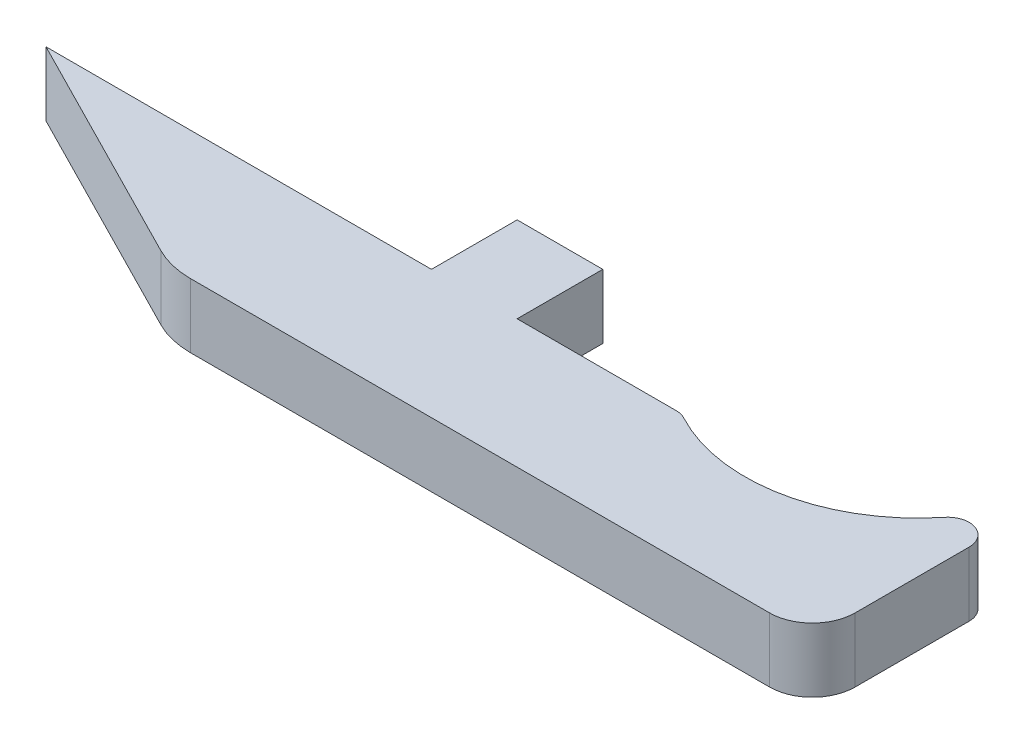
from build123d import *

# Parameters (mm, degrees)
BOSS_EXTRUDE1_DEPTH = 4.7625
FILLET1_R           = 1.5875
FILLET2_R           = 6.35
FILLET3_R           = 3.175
SKETCH6_W           = 6.35
SKETCH6_H           = 4.7625
BOSS_EXTRUDE2_DEPTH = 6.35


with BuildPart() as part:
    # Sketch1 → Boss-Extrude1 (new body)
    with BuildSketch(Plane(origin=(0, 0, 0), x_dir=(1, 0, 0), z_dir=(0, 1, 0))):
        with BuildLine():
            ThreePointArc((71.8566, -0.863168416), (65.45758311, -11.963301845), (52.645098926, -11.988368416))
            Line((52.645098926, -11.988368416), (5.5225, -11.988368416))
            Line((5.5225, -11.988368416), (24.2316, -21.513368416))
            Line((24.2316, -21.513368416), (71.8566, -21.513368416))
            Line((71.8566, -21.513368416), (71.8566, -0.863168416))
        make_face()
    extrude(amount=BOSS_EXTRUDE1_DEPTH)

    # Fillet1
    fillet1_edges = [part.edges().sort_by_distance(p)[0] for p in [
        (52.645098926, 2.38125, 11.988368416),
        (71.8566, 2.38125, 0.863168416),
    ]]
    fillet(fillet1_edges, radius=FILLET1_R)

    # Fillet2
    fillet2_edges = [part.edges().sort_by_distance(p)[0] for p in [
        (24.2316, 2.38125, 21.513368416),
    ]]
    fillet(fillet2_edges, radius=FILLET2_R)

    # Fillet3
    fillet3_edges = [part.edges().sort_by_distance(p)[0] for p in [
        (71.8566, 2.38125, 21.513368416),
    ]]
    fillet(fillet3_edges, radius=FILLET3_R)

    # Sketch6 → Boss-Extrude2 (add)
    with BuildSketch(Plane(origin=(0, 0, 11.988368416), x_dir=(-1, 0, 0), z_dir=(0, 0, -1))):
        with Locations((-37.2725, 2.38125)):
            Rectangle(SKETCH6_W, SKETCH6_H)
    extrude(amount=BOSS_EXTRUDE2_DEPTH)


solid = part.part
